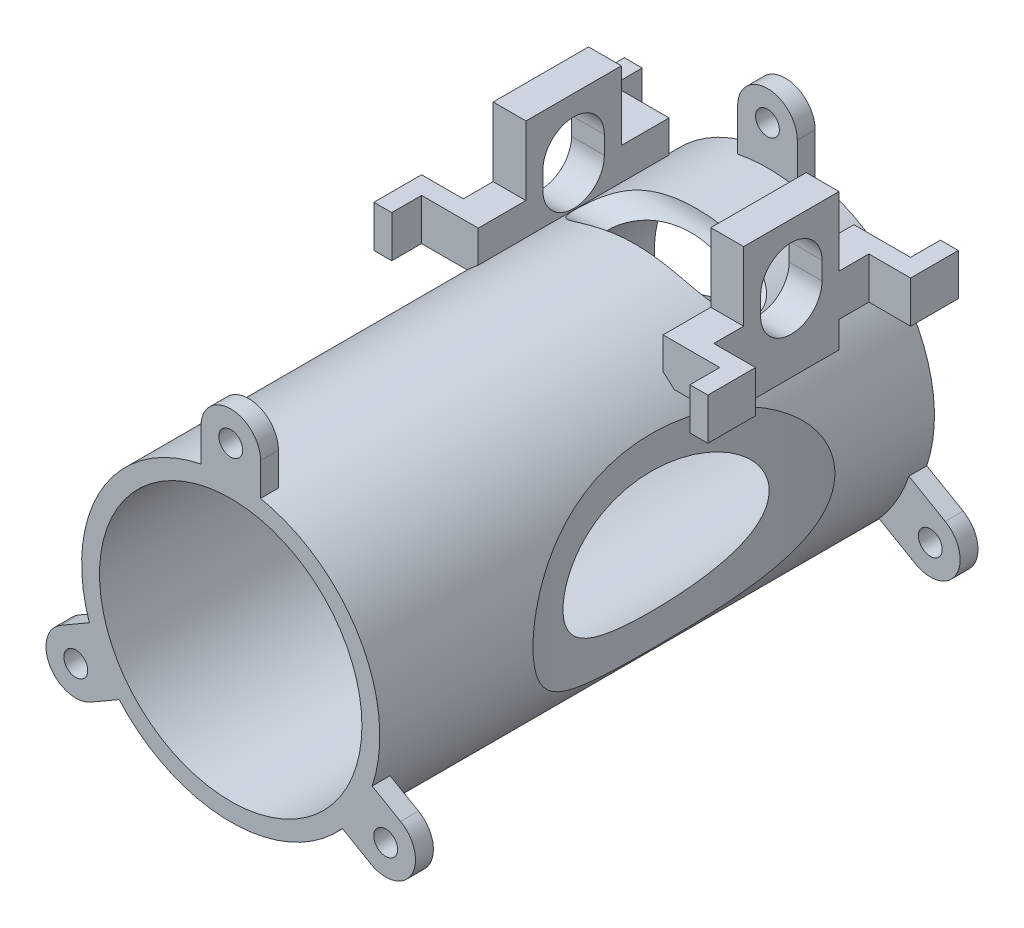
from build123d import *

# Parameters (mm, degrees)
SKETCH1_R               = 25
SKETCH1_R_2             = 22
BOSS_EXTRUDE1_DEPTH     = 40
SKETCH3_R               = 5.15
CUT_EXTRUDE1_DEPTH      = 25
SKETCH7_R               = 25
SKETCH7_R_2             = 22
BOSS_EXTRUDE4_DEPTH     = 53
SKETCH9_R               = 2
BOSS_EXTRUDE5_DEPTH     = 3
CIRPATTERN1_COUNT       = 3
BOSS_EXTRUDE6_START     = -3
SKETCH10_R              = 2
BOSS_EXTRUDE6_DEPTH     = 3
CIRPATTERN2_COUNT       = 3
BOSS_EXTRUDE7_DEPTH     = 8
CUT_EXTRUDE5_START      = -16
CUT_EXTRUDE5_DEPTH      = 16
BOSS_EXTRUDE8_DEPTH     = 7
MIRROR2_COPY_1_DEPTH    = 7
CUT_EXTRUDE4_DEPTH      = 6
CUT_EXTRUDE4_DEPTH_BACK = 41
SKETCH12_R              = 61


with BuildPart() as part:
    # Sketch1 → Boss-Extrude1 (new body)
    with BuildSketch(Plane.XY):
        Circle(SKETCH1_R)
        Circle(SKETCH1_R_2, mode=Mode.SUBTRACT)
    extrude(amount=BOSS_EXTRUDE1_DEPTH)

    # Sketch3 → Cut-Extrude1 (cut, symmetric)
    with BuildSketch(Plane(origin=(0, 0, 0), x_dir=(0, 0, -1), z_dir=(1, 0, 0))):
        with Locations((-20, 25)):
            Circle(SKETCH3_R)
    extrude(amount=CUT_EXTRUDE1_DEPTH, both=True, mode=Mode.SUBTRACT)

    # Sketch7 → Boss-Extrude4 (add)
    with BuildSketch(Plane.XY.offset(40)):
        Circle(SKETCH7_R)
        Circle(SKETCH7_R_2, mode=Mode.SUBTRACT)
    extrude(amount=BOSS_EXTRUDE4_DEPTH)

    # Sketch9 → Boss-Extrude5 (add)
    with BuildSketch(Plane(origin=(0, 0, 0), x_dir=(-1, 0, 0), z_dir=(0, 0, -1))):
        with BuildLine():
            Line((5, 24.494897428), (5, 31.532998323))
            ThreePointArc((5, 31.532998323), (0, 36.532998323), (-5, 31.532998323))
            Line((-5, 31.532998323), (-5, 24.494897428))
            ThreePointArc((-5, 24.494897428), (0, 25), (5, 24.494897428))
        make_face()
        with Locations((0, 31.532998323)):
            Circle(SKETCH9_R, mode=Mode.SUBTRACT)
    boss_extrude5 = extrude(amount=-BOSS_EXTRUDE5_DEPTH)

    # CirPattern1: Boss-Extrude5 ×3 about axis
    cirpattern1_axis = Axis((0, 0, 0), (0, 0, 1))
    for i in range(1, CIRPATTERN1_COUNT):
        add(boss_extrude5.rotate(cirpattern1_axis, i * 360 / CIRPATTERN1_COUNT))

    # Sketch10 → Boss-Extrude6 (add)
    with BuildSketch(Plane.XY.offset(93).offset(BOSS_EXTRUDE6_START)):
        with BuildLine():
            ThreePointArc((-5, 24.494897428), (0, 25), (5, 24.494897428))
            Line((5, 24.494897428), (5, 30))
            ThreePointArc((5, 30), (0, 35), (-5, 30))
            Line((-5, 30), (-5, 24.494897428))
        make_face()
        with Locations((0, 30)):
            Circle(SKETCH10_R, mode=Mode.SUBTRACT)
    boss_extrude6 = extrude(amount=BOSS_EXTRUDE6_DEPTH)

    # CirPattern2: Boss-Extrude6 ×3 about axis
    cirpattern2_axis = Axis((0, 0, 93), (0, 0, 1))
    for i in range(1, CIRPATTERN2_COUNT):
        add(boss_extrude6.rotate(cirpattern2_axis, i * 360 / CIRPATTERN2_COUNT))

    # Sketch14 → Boss-Extrude7 (add, symmetric)
    with BuildSketch(Plane.XY.offset(20)):
        with BuildLine():
            Line((-21, 13.564659966), (-21, 36.564659966))
            Line((-21, 36.564659966), (-15.5, 36.564659966))
            Line((-15.5, 36.564659966), (-15.5, 19.615045246))
            ThreePointArc((-15.5, 19.615045246), (-18.499034853, 16.816233511), (-21, 13.564659966))
        make_face()
    boss_extrude7 = extrude(amount=BOSS_EXTRUDE7_DEPTH, both=True)

    # Sketch15 → Cut-Extrude5 (cut)
    with BuildSketch(Plane.ZY.offset(21).offset(CUT_EXTRUDE5_START)):
        with BuildLine():
            Line((14.85, 25), (14.85, 28))
            ThreePointArc((14.85, 28), (20, 33.15), (25.15, 28))
            Line((25.15, 28), (25.15, 25))
            ThreePointArc((25.15, 25), (20, 19.85), (14.85, 25))
        make_face()
    cut_extrude5 = extrude(amount=CUT_EXTRUDE5_DEPTH, mode=Mode.SUBTRACT)

    # Sketch17 → Boss-Extrude8 (add)
    with BuildSketch(Plane(origin=(0, 25, 0), x_dir=(1, 0, 0), z_dir=(0, 1, 0))):
        Polygon((-15.5, -28), (-21, -28), (-21, -33), (-28, -33), (-28, -41), (-25, -41), (-25, -36), (-15.5, -36), align=None)
    boss_extrude8 = extrude(amount=-BOSS_EXTRUDE8_DEPTH)

    # Mirror1: Boss-Extrude8 across plane
    add(boss_extrude8.mirror(Plane.XY.offset(20)))

    # Mirror2: Boss-Extrude7, Cut-Extrude5, Boss-Extrude8 across plane
    add(boss_extrude7.mirror(Plane(origin=(0, 0, 0), x_dir=(0, 0, 1), z_dir=(1, 0, 0))))
    add(cut_extrude5.mirror(Plane(origin=(0, 0, 0), x_dir=(0, 0, 1), z_dir=(1, 0, 0))), mode=Mode.SUBTRACT)
    add(boss_extrude8.mirror(Plane(origin=(0, 0, 0), x_dir=(0, 0, 1), z_dir=(1, 0, 0))))

    # Mirror2 copy 1 sketch → Mirror2 copy 1 (add)
    with BuildSketch(Plane(origin=(0, 25, 40), x_dir=(-1, 0, 0), z_dir=(0, 1, 0))):
        Polygon((-15.5, -28), (-21, -28), (-21, -33), (-28, -33), (-28, -41), (-25, -41), (-25, -36), (-15.5, -36), align=None)
    extrude(amount=-MIRROR2_COPY_1_DEPTH)

    # Sketch12 → Cut-Extrude4 (cut, two sides: drawn at the far end of the back side and taken through both)
    with BuildSketch(Plane(origin=(0, 11.51, 0), x_dir=(1, 0, 0), z_dir=(0, 1, 0)).offset(-CUT_EXTRUDE4_DEPTH_BACK)):
        with Locations((-80.5, -42)):
            Circle(SKETCH12_R)
        with Locations((80.5, -42)):
            Circle(SKETCH12_R)
    extrude(amount=CUT_EXTRUDE4_DEPTH + CUT_EXTRUDE4_DEPTH_BACK, mode=Mode.SUBTRACT)


solid = part.part
